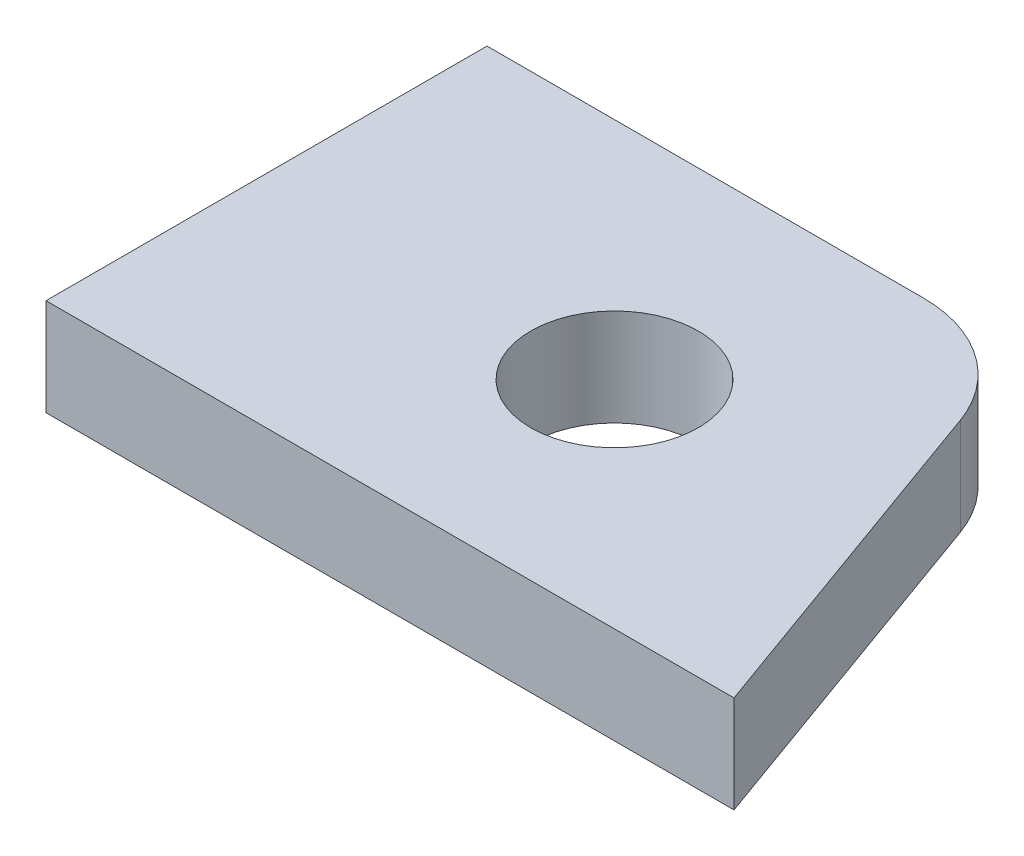
from build123d import *

# Parameters (mm, degrees)
SKETCH1_R           = 9.5
BOSS_EXTRUDE1_DEPTH = 11


with BuildPart() as part:
    # Sketch1 → Boss-Extrude1 (new body)
    with BuildSketch(Plane(origin=(0, 0, 0), x_dir=(1, 0, 0), z_dir=(0, 1, 0))):
        with BuildLine():
            Line((0, 0), (78, 0))
            Line((78, 0), (63.570914871, 40.080792024))
            ThreePointArc((63.570914871, 40.080792024), (58.082802811, 47.272161186), (49.457603693, 50))
            Line((49.457603693, 50), (0, 50))
            Line((0, 50), (0, 0))
        make_face()
        with Locations((39.952273438, 24.5)):
            Circle(SKETCH1_R, mode=Mode.SUBTRACT)
    extrude(amount=BOSS_EXTRUDE1_DEPTH)


solid = part.part
